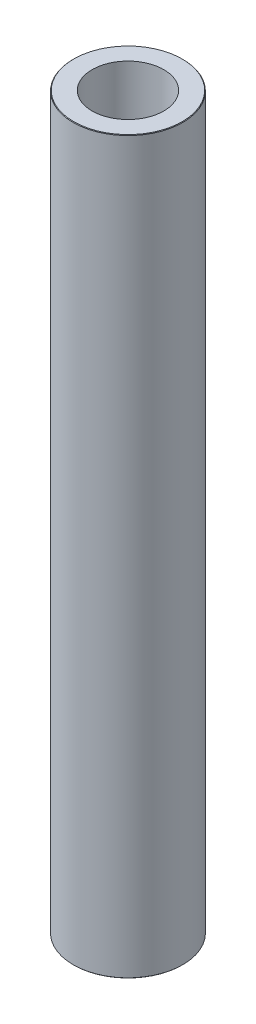
from build123d import *

# Parameters (mm, degrees)
SKETCH1_R           = 45
BOSS_EXTRUDE1_DEPTH = 600
SKETCH2_R           = 29.447960672
CUT_EXTRUDE1_DEPTH  = 604.365560834
CHAMFER1_SIZE       = 0.423369444


with BuildPart() as part:
    # Sketch1 → Boss-Extrude1 (new body)
    with BuildSketch(Plane(origin=(0, 0, 0), x_dir=(1, 0, 0), z_dir=(0, 1, 0))):
        Circle(SKETCH1_R)
    extrude(amount=BOSS_EXTRUDE1_DEPTH)

    # Sketch2 → Cut-Extrude1 (cut, through all)
    with BuildSketch(Plane(origin=(0, 0, 0), x_dir=(1, 0, 0), z_dir=(0, 1, 0))):
        Circle(SKETCH2_R)
    extrude(amount=CUT_EXTRUDE1_DEPTH, mode=Mode.SUBTRACT)

    # Chamfer1
    chamfer1_edges = [part.edges().sort_by_distance(p)[0] for p in [
        (-45, 600, 0),
        (-45, 0, 0),
    ]]
    chamfer(chamfer1_edges, length=CHAMFER1_SIZE)


solid = part.part
